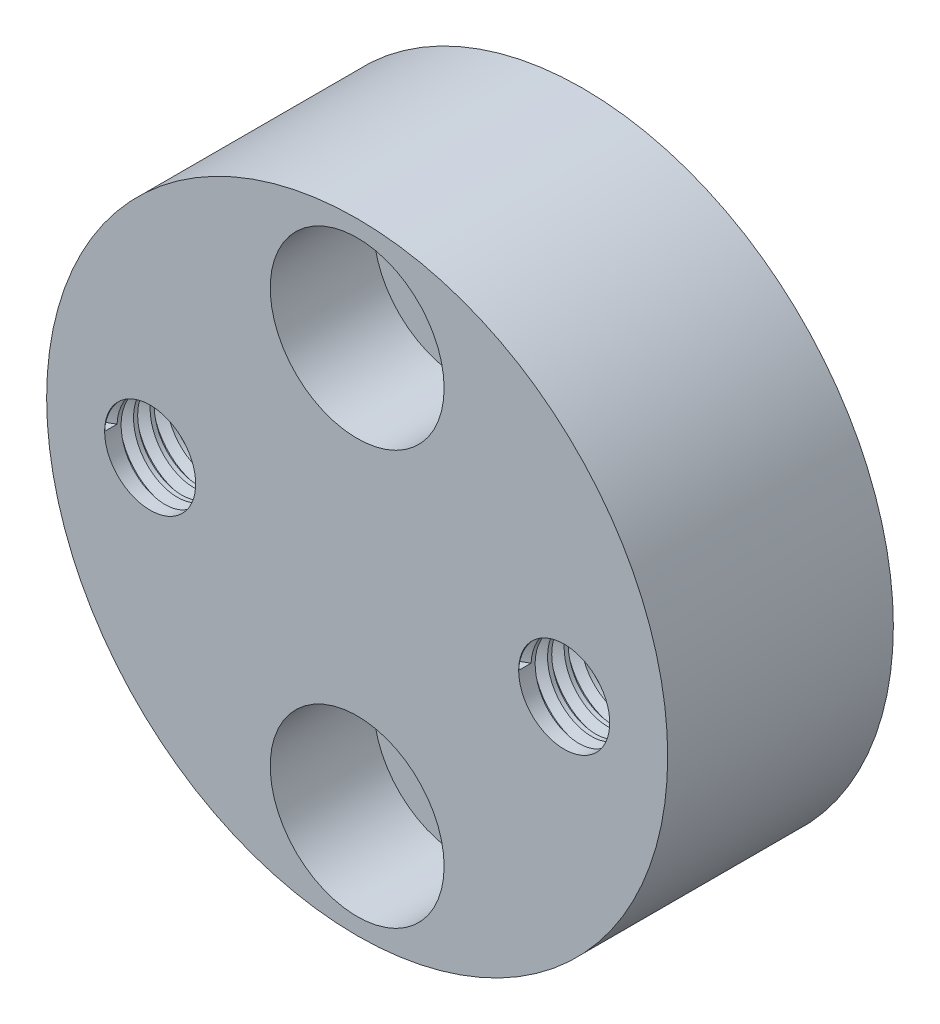
from build123d import *

# Parameters (mm, degrees)
SKIZZE1_R                       = 15
AUFSATZ_LINEAR_AUSTRAGEN1_DEPTH = 10.9
SKIZZE2_R                       = 2.5
SKIZZE2_R_2                     = 2.2
SCHNITT_LINEAR_AUSTRAGEN1_DEPTH = 33
SKIZZE3_R                       = 4.2
SCHNITT_LINEAR_AUSTRAGEN2_DEPTH = 5
GEWINDE1_PITCH                  = 0.8
GEWINDE2_PITCH                  = 0.8


with BuildPart() as part:
    # Skizze1 → Aufsatz-Linear austragen1 (new body)
    with BuildSketch(Plane.XY):
        Circle(SKIZZE1_R)
    extrude(amount=AUFSATZ_LINEAR_AUSTRAGEN1_DEPTH)

    # Skizze2 → Schnitt-Linear austragen1 (cut)
    with BuildSketch(Plane.XY.offset(10.9)):
        with Locations((0, 10)):
            Circle(SKIZZE2_R)
        with Locations((10, 0)):
            Circle(SKIZZE2_R_2)
        with Locations((0, -10)):
            Circle(SKIZZE2_R)
        with Locations((-10, 0)):
            Circle(SKIZZE2_R_2)
    extrude(amount=-SCHNITT_LINEAR_AUSTRAGEN1_DEPTH, mode=Mode.SUBTRACT)

    # Skizze3 → Schnitt-Linear austragen2 (cut)
    with BuildSketch(Plane.XY.offset(10.9)):
        with Locations((0, 10)):
            Circle(SKIZZE3_R)
        with Locations((0, -10)):
            Circle(SKIZZE3_R)
    extrude(amount=-SCHNITT_LINEAR_AUSTRAGEN2_DEPTH, mode=Mode.SUBTRACT)

    # Gewinde1: arcs per turn and ends read off the stored shape
    # Gewinde1: the profile of Gewindeprofil1 profile screwed along a right-hand helix through 25 turns, 8 arcs to a turn; built about Z, then put on its axis
    gewinde1_z = Axis((0, 0, 0), (0, 0, 1))
    gewinde1_corners = [(2.1997, 0, -0.000173205), (2.6330127, 0, 0.249999999), (2.6330127, 0, 0.349999999), (2.1997, 0, 0.600173203)]
    with BuildLine(mode=Mode.PRIVATE) as gewinde1_profile:
        Line(gewinde1_corners[0], gewinde1_corners[1])
        Line(gewinde1_corners[1], gewinde1_corners[2])
        Line(gewinde1_corners[2], gewinde1_corners[3])
        Line(gewinde1_corners[3], gewinde1_corners[0])
    gewinde1_cap = Face(gewinde1_profile.wire())
    gewinde1_turn_angles = [0, 22.5, 45, 67.5, 90, 112.5, 135, 157.5, 180, 202.5, 225, 247.5, 270, 292.5, 315, 337.5, 360]
    gewinde1_turn_weights = [1, 0.9238795325112867, 1, 0.9238795325112867, 1, 0.9238795325112867, 1, 0.9238795325112867, 1, 0.9238795325112867, 1, 0.9238795325112867, 1, 0.9238795325112867, 1, 0.9238795325112867, 1]
    gewinde1_turn_rails = [Edge.make_bspline([Vector(p[0], p[1], 0).rotate(gewinde1_z, gewinde1_turn_angles[k]) / gewinde1_turn_weights[k] + Vector(0, 0, p[2] + GEWINDE1_PITCH * gewinde1_turn_angles[k] / 360) for k in range(17)], [0, 0, 0, 1, 1, 2, 2, 3, 3, 4, 4, 5, 5, 6, 6, 7, 7, 8, 8, 8], 2, gewinde1_turn_weights) for p in gewinde1_corners]
    gewinde1_turn_sides = [Face.make_surface_from_curves(gewinde1_turn_rails[p[0]], gewinde1_turn_rails[p[1]]) for p in [(0, 1), (1, 2), (2, 3), (3, 0)]]
    gewinde1 = Plane(origin=(-10, 0, 10.9), x_dir=(-1, 0, 0), z_dir=(0, 0, -1)) * Solid(Shell([*[p.moved(Location((0, 0, GEWINDE1_PITCH * i))) for i in range(25) for p in gewinde1_turn_sides], gewinde1_cap, gewinde1_cap.rotate(gewinde1_z, 9000).moved(Location((0, 0, GEWINDE1_PITCH * 9000 / 360)))]))
    add(gewinde1, mode=Mode.SUBTRACT)

    # Gewinde2: arcs per turn and ends read off the stored shape
    # Gewinde2: the profile of Gewindeprofil2 profile screwed along a right-hand helix through 25 turns, 8 arcs to a turn; built about Z, then put on its axis
    gewinde2_z = Axis((0, 0, 0), (0, 0, 1))
    gewinde2_corners = [(2.1997, 0, -0.000173205), (2.6330127, 0, 0.249999999), (2.6330127, 0, 0.349999999), (2.1997, 0, 0.600173203)]
    with BuildLine(mode=Mode.PRIVATE) as gewinde2_profile:
        Line(gewinde2_corners[0], gewinde2_corners[1])
        Line(gewinde2_corners[1], gewinde2_corners[2])
        Line(gewinde2_corners[2], gewinde2_corners[3])
        Line(gewinde2_corners[3], gewinde2_corners[0])
    gewinde2_cap = Face(gewinde2_profile.wire())
    gewinde2_turn_angles = [0, 22.5, 45, 67.5, 90, 112.5, 135, 157.5, 180, 202.5, 225, 247.5, 270, 292.5, 315, 337.5, 360]
    gewinde2_turn_weights = [1, 0.9238795325112867, 1, 0.9238795325112867, 1, 0.9238795325112867, 1, 0.9238795325112867, 1, 0.9238795325112867, 1, 0.9238795325112867, 1, 0.9238795325112867, 1, 0.9238795325112867, 1]
    gewinde2_turn_rails = [Edge.make_bspline([Vector(p[0], p[1], 0).rotate(gewinde2_z, gewinde2_turn_angles[k]) / gewinde2_turn_weights[k] + Vector(0, 0, p[2] + GEWINDE2_PITCH * gewinde2_turn_angles[k] / 360) for k in range(17)], [0, 0, 0, 1, 1, 2, 2, 3, 3, 4, 4, 5, 5, 6, 6, 7, 7, 8, 8, 8], 2, gewinde2_turn_weights) for p in gewinde2_corners]
    gewinde2_turn_sides = [Face.make_surface_from_curves(gewinde2_turn_rails[p[0]], gewinde2_turn_rails[p[1]]) for p in [(0, 1), (1, 2), (2, 3), (3, 0)]]
    gewinde2 = Plane(origin=(10, 0, 10.9), x_dir=(-1, 0, 0), z_dir=(0, 0, -1)) * Solid(Shell([*[p.moved(Location((0, 0, GEWINDE2_PITCH * i))) for i in range(25) for p in gewinde2_turn_sides], gewinde2_cap, gewinde2_cap.rotate(gewinde2_z, 9000).moved(Location((0, 0, GEWINDE2_PITCH * 9000 / 360)))]))
    add(gewinde2, mode=Mode.SUBTRACT)


solid = part.part
